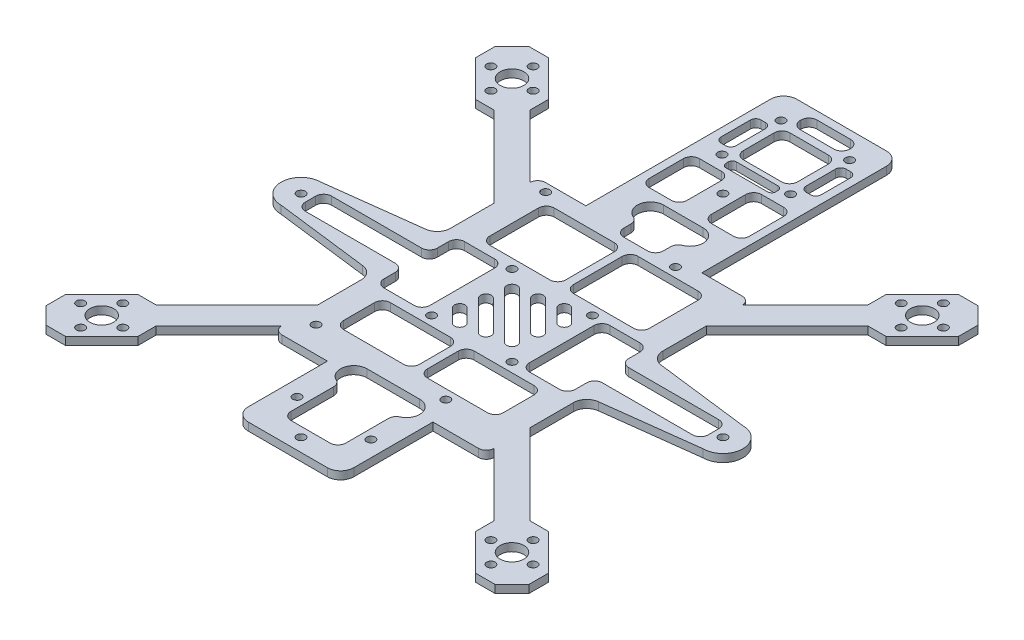
from build123d import *

# Parameters (mm, degrees)
SKETCH_1_R          = 1.6
EXTRUDE_1_DEPTH     = 3
SKETCH_6_R          = 1.6
EXTRUDE_3_DEPTH     = 3
SKETCH_7_R          = 1.6
CUT_EXTRUDE_5_DEPTH = 130.480195498
SKETCH_8_W          = 44
SKETCH_8_H          = 75
SKETCH_8_R          = 1.6
EXTRUDE_4_DEPTH     = 3
FILLET_1_R          = 5
FILLET_2_R          = 3
SKETCH_9_R          = 4.5
CUT_EXTRUDE_6_DEPTH = 155.958254098
FILLET_3_R          = 3


with BuildPart() as part:
    # 草图1 → 凸台-拉伸1 (new body)
    with BuildSketch(Plane(origin=(0, 0, 0), x_dir=(1, 0, 0), z_dir=(0, 1, 0))):
        with BuildLine():
            Line((-40.28, -16.916429648), (-40.28, -50))
            Line((-40.28, -50), (-20, -50))
            Line((-20, -50), (-20, -85))
            Line((-20, -85), (20, -85))
            Line((20, -85), (20, -50))
            Line((20, -50), (40.28, -50))
            Line((40.28, -50), (40.28, -16.916429648))
            ThreePointArc((40.28, -16.916429648), (41.5325458, -13.606356081), (44.662634807, -11.954690012))
            Line((44.662634807, -11.954690012), (80, -7.557833088))
            ThreePointArc((80, -7.557833088), (87.557833088, 0), (80, 7.557833088))
            Line((80, 7.557833088), (44.662634807, 11.954690012))
            ThreePointArc((44.662634807, 11.954690012), (41.5325458, 13.606356081), (40.28, 16.916429648))
            Line((40.28, 16.916429648), (40.28, 50))
            Line((40.28, 50), (-40.28, 50))
            Line((-40.28, 50), (-40.28, 16.916429648))
            ThreePointArc((-40.28, 16.916429648), (-41.5325458, 13.606356081), (-44.662634807, 11.954690012))
            Line((-44.662634807, 11.954690012), (-80, 7.557833088))
            ThreePointArc((-80, 7.557833088), (-87.557833088, 0), (-80, -7.557833088))
            Line((-80, -7.557833088), (-44.662634807, -11.954690012))
            ThreePointArc((-44.662634807, -11.954690012), (-41.5325458, -13.606356081), (-40.28, -16.916429648))
        make_face()
        with Locations(Location((-34.12, -40.19, 0), (0, 0, 270))):
            Circle(SKETCH_1_R, mode=Mode.SUBTRACT)
        with Locations(Location((15.09, -40.19, 0), (0, 0, 270))):
            Circle(SKETCH_1_R, mode=Mode.SUBTRACT)
        with Locations(Location((-80, 0, 0), (0, 0, 270))):
            Circle(SKETCH_1_R, mode=Mode.SUBTRACT)
        with Locations(Location((-15.25, -15.25, 0), (0, 0, 270))):
            Circle(SKETCH_1_R, mode=Mode.SUBTRACT)
        with Locations(Location((-15.25, 15.25, 0), (0, 0, 270))):
            Circle(SKETCH_1_R, mode=Mode.SUBTRACT)
        with Locations(Location((-34.12, 46.89, 0), (0, 0, 270))):
            Circle(SKETCH_1_R, mode=Mode.SUBTRACT)
        with Locations(Location((15.25, -15.25, 0), (0, 0, 270))):
            Circle(SKETCH_1_R, mode=Mode.SUBTRACT)
        with Locations(Location((15.25, 15.25, 0), (0, 0, 270))):
            Circle(SKETCH_1_R, mode=Mode.SUBTRACT)
        with Locations(Location((80, 0, 0), (0, 0, 270))):
            Circle(SKETCH_1_R, mode=Mode.SUBTRACT)
        with Locations(Location((15.09, 46.89, 0), (0, 0, 270))):
            Circle(SKETCH_1_R, mode=Mode.SUBTRACT)
        with Locations(Location((14, -67.5, 0), (0, 0, 270))):
            Circle(SKETCH_1_R, mode=Mode.SUBTRACT)
        with Locations(Location((-14, -67.5, 0), (0, 0, 270))):
            Circle(SKETCH_1_R, mode=Mode.SUBTRACT)
    extrude(amount=EXTRUDE_1_DEPTH)

    # 草图6 → 凸台-拉伸3 (add)
    # profile 1 of 4: a face of its own
    with BuildSketch(Plane(origin=(0, 0, 0), x_dir=(1, 0, 0), z_dir=(0, 1, 0))):
        Polygon((-40.28, 33.405), (-40.28, 47.155), (-64.031745931, 70.906745931), (-64.031745931, 77.781745931), (-77.781745931, 91.531745931), (-85.1677849, 91.531745931), (-91.531745931, 85.1677849), (-91.531745931, 77.781745931), (-77.781745931, 64.031745931), (-70.906745931, 64.031745931), align=None)
        with Locations(Location((-85.781745931, 77.781745931, 0), (0, 0, 270))):
            Circle(SKETCH_6_R, mode=Mode.SUBTRACT)
        with Locations(Location((-77.781745931, 69.781745931, 0), (0, 0, 270))):
            Circle(SKETCH_6_R, mode=Mode.SUBTRACT)
        with Locations(Location((-69.781745931, 77.781745931, 0), (0, 0, 270))):
            Circle(SKETCH_6_R, mode=Mode.SUBTRACT)
        with Locations(Location((-77.781745931, 85.781745931, 0), (0, 0, 270))):
            Circle(SKETCH_6_R, mode=Mode.SUBTRACT)
    # profile 2 of 4: a face of its own
    with BuildSketch(Plane(origin=(0, 0, 0), x_dir=(1, 0, 0), z_dir=(0, 1, 0))):
        Polygon((85.1677849, 91.531745931), (77.781745931, 91.531745931), (64.031745931, 77.781745931), (64.031745931, 70.906745931), (40.28, 47.155), (40.28, 33.405), (70.906745931, 64.031745931), (77.781745931, 64.031745931), (91.531745931, 77.781745931), (91.531745931, 85.1677849), align=None)
        with Locations(Location((77.781745931, 69.781745931, 0), (0, 0, 270))):
            Circle(SKETCH_6_R, mode=Mode.SUBTRACT)
        with Locations(Location((69.781745931, 77.781745931, 0), (0, 0, 270))):
            Circle(SKETCH_6_R, mode=Mode.SUBTRACT)
        with Locations(Location((85.781745931, 77.781745931, 0), (0, 0, 270))):
            Circle(SKETCH_6_R, mode=Mode.SUBTRACT)
        with Locations(Location((77.781745931, 85.781745931, 0), (0, 0, 270))):
            Circle(SKETCH_6_R, mode=Mode.SUBTRACT)
    # profile 3 of 4: a face of its own
    with BuildSketch(Plane(origin=(0, 0, 0), x_dir=(1, 0, 0), z_dir=(0, 1, 0))):
        Polygon((70.906745931, -64.031745931), (40.28, -33.405), (40.28, -47.155), (64.031745931, -70.906745931), (64.031745931, -77.781745931), (77.781745931, -91.531745931), (85.1677849, -91.531745931), (91.531745931, -85.1677849), (91.531745931, -77.781745931), (77.781745931, -64.031745931), align=None)
        with Locations(Location((77.781745931, -85.781745931, 0), (0, 0, 270))):
            Circle(SKETCH_6_R, mode=Mode.SUBTRACT)
        with Locations(Location((69.781745931, -77.781745931, 0), (0, 0, 270))):
            Circle(SKETCH_6_R, mode=Mode.SUBTRACT)
        with Locations(Location((77.781745931, -69.781745931, 0), (0, 0, 270))):
            Circle(SKETCH_6_R, mode=Mode.SUBTRACT)
        with Locations(Location((85.781745931, -77.781745931, 0), (0, 0, 270))):
            Circle(SKETCH_6_R, mode=Mode.SUBTRACT)
    # profile 4 of 4: a face of its own
    with BuildSketch(Plane(origin=(0, 0, 0), x_dir=(1, 0, 0), z_dir=(0, 1, 0))):
        Polygon((-40.28, -47.155), (-40.28, -33.405), (-70.906745931, -64.031745931), (-77.781745931, -64.031745931), (-91.531745931, -77.781745931), (-91.531745931, -85.1677849), (-85.1677849, -91.531745931), (-77.781745931, -91.531745931), (-64.031745931, -77.781745931), (-64.031745931, -70.906745931), align=None)
        with Locations(Location((-77.781745931, -85.781745931, 0), (0, 0, 270))):
            Circle(SKETCH_6_R, mode=Mode.SUBTRACT)
        with Locations(Location((-85.781745931, -77.781745931, 0), (0, 0, 270))):
            Circle(SKETCH_6_R, mode=Mode.SUBTRACT)
        with Locations(Location((-69.781745931, -77.781745931, 0), (0, 0, 270))):
            Circle(SKETCH_6_R, mode=Mode.SUBTRACT)
        with Locations(Location((-77.781745931, -69.781745931, 0), (0, 0, 270))):
            Circle(SKETCH_6_R, mode=Mode.SUBTRACT)
    extrude(amount=EXTRUDE_3_DEPTH)

    # 草图7 → 切除-拉伸5 (cut, through all)
    with BuildSketch(Plane(origin=(0, 0, 0), x_dir=(1, 0, 0), z_dir=(0, 1, 0))):
        with BuildLine():
            ThreePointArc((-6.01040764, -10.960155108), (-6.01040764, -13.788582233), (-8.838834765, -13.788582233))
            Line((-8.838834765, -13.788582233), (-13.788582233, -8.838834765))
            ThreePointArc((-13.788582233, -8.838834765), (-13.788582233, -6.01040764), (-10.960155108, -6.01040764))
            Line((-10.960155108, -6.01040764), (-6.01040764, -10.960155108))
        make_face()
        with BuildLine():
            ThreePointArc((2.121320344, -9.192388155), (2.121320344, -12.02081528), (-0.707106781, -12.02081528))
            Line((-0.707106781, -12.02081528), (-12.02081528, -0.707106781))
            ThreePointArc((-12.02081528, -0.707106781), (-12.02081528, 2.121320344), (-9.192388155, 2.121320344))
            Line((-9.192388155, 2.121320344), (2.121320344, -9.192388155))
        make_face()
        with BuildLine():
            Line((-10.253048327, 7.424621202), (7.424621202, -10.253048327))
            ThreePointArc((7.424621202, -10.253048327), (10.253048327, -10.253048327), (10.253048327, -7.424621202))
            Line((10.253048327, -7.424621202), (-7.424621202, 10.253048327))
            ThreePointArc((-7.424621202, 10.253048327), (-10.253048327, 10.253048327), (-10.253048327, 7.424621202))
        make_face()
        with BuildLine():
            Line((-2.121320344, 9.192388155), (9.192388155, -2.121320344))
            ThreePointArc((9.192388155, -2.121320344), (12.02081528, -2.121320344), (12.02081528, 0.707106781))
            Line((12.02081528, 0.707106781), (0.707106781, 12.02081528))
            ThreePointArc((0.707106781, 12.02081528), (-2.121320344, 12.02081528), (-2.121320344, 9.192388155))
        make_face()
        with BuildLine():
            Line((6.01040764, 10.960155108), (10.960155108, 6.01040764))
            ThreePointArc((10.960155108, 6.01040764), (13.788582233, 6.01040764), (13.788582233, 8.838834765))
            Line((13.788582233, 8.838834765), (8.838834765, 13.788582233))
            ThreePointArc((8.838834765, 13.788582233), (6.01040764, 13.788582233), (6.01040764, 10.960155108))
        make_face()
        with BuildLine():
            Line((-10, -55), (10, -55))
            ThreePointArc((10, -55), (15, -50), (10, -45))
            Line((10, -45), (-10, -45))
            ThreePointArc((-10, -45), (-15, -50), (-10, -55))
        make_face()
        with Locations(Location((0, -80, 0), (0, 0, 270))):
            Circle(SKETCH_7_R)
    extrude(amount=CUT_EXTRUDE_5_DEPTH, mode=Mode.SUBTRACT)

    # 草图8 → 凸台-拉伸4 (add)
    with BuildSketch(Plane(origin=(0, 0, 0), x_dir=(1, 0, 0), z_dir=(0, 1, 0))):
        with Locations((0, 87.5)):
            Rectangle(SKETCH_8_W, SKETCH_8_H)
        with Locations(Location((13, 115, 0), (0, 0, 270))):
            Circle(SKETCH_8_R, mode=Mode.SUBTRACT)
        with Locations(Location((-13, 115, 0), (0, 0, 90))):
            Circle(SKETCH_8_R, mode=Mode.SUBTRACT)
        with Locations(Location((13, 92.63, 0), (0, 0, 270))):
            Circle(SKETCH_8_R, mode=Mode.SUBTRACT)
        with Locations(Location((-13, 92.63, 0), (0, 0, 90))):
            Circle(SKETCH_8_R, mode=Mode.SUBTRACT)
        with Locations(Location((0, 80, 0), (0, 0, 270))):
            Circle(SKETCH_8_R, mode=Mode.SUBTRACT)
        with BuildLine():
            Line((-7.5, 65), (7.5, 65))
            ThreePointArc((7.5, 65), (12.5, 60), (7.5, 55))
            Line((7.5, 55), (-7.5, 55))
            ThreePointArc((-7.5, 55), (-12.5, 60), (-7.5, 65))
        make_face(mode=Mode.SUBTRACT)
    extrude(amount=EXTRUDE_4_DEPTH)

    # 圆角1
    fillet_1_edges = [part.edges().sort_by_distance(p)[0] for p in [
        (22, 1.5, -125),
        (-22, 1.5, -125),
        (20, 1.5, 85),
        (-20, 1.5, 85),
    ]]
    fillet(fillet_1_edges, radius=FILLET_1_R)

    # 圆角2
    # the kernel refuses this fillet: 3 mm, written as the material it takes off along each edge
    with BuildSketch(Plane(origin=(-40.28, -7.489982894, 50), x_dir=(1, 0, 0), z_dir=(0, 1, 0))) as fillet_2_piece_1_section:
        with BuildLine():
            CenterArc((2.995993158, 3), FILLET_2_R, 182.961600578, 87.038399422)
            Line((0, 2.845), (-0.059919863, 2.8419))
            ThreePointArc((-0.059919863, 2.8419), (-0.06, 1.4225), (-0.06, 0))
            Line((-0.06, 0), (0, -0.06))
            Line((0, -0.06), (2.995993158, -0.06))
            Line((2.995993158, -0.06), (2.995993158, 0))
        make_face()
    fillet_2_piece_1 = extrude(amount=17.979965788, mode=Mode.PRIVATE)
    fillet_2_piece_1 = split(fillet_2_piece_1, bisect_by=Plane(origin=(-41.028477844, 1.5, 47.903477844), z_dir=(0.7071067811865611, 0, 0.7071067811865339)), keep=Keep.TOP, mode=Mode.PRIVATE)
    add(fillet_2_piece_1, mode=Mode.SUBTRACT)
    with BuildSketch(Plane(origin=(40.28, -7.489982894, 50), x_dir=(-1, 0, 0), z_dir=(0, 1, 0))) as fillet_2_piece_2_section:
        with BuildLine():
            CenterArc((2.995993158, -3), FILLET_2_R, 90, 87.038399422)
            Line((0, -2.845), (-0.059919863, -2.8419))
            ThreePointArc((-0.059919863, -2.8419), (-0.06, -1.4225), (-0.06, 0))
            Line((-0.06, 0), (0, 0.06))
            Line((0, 0.06), (2.995993158, 0.06))
            Line((2.995993158, 0.06), (2.995993158, 0))
        make_face()
    fillet_2_piece_2 = extrude(amount=17.979965788, mode=Mode.PRIVATE)
    fillet_2_piece_2 = split(fillet_2_piece_2, bisect_by=Plane(origin=(41.028477844, 1.5, 47.903477844), z_dir=(-0.7071067811865506, 0, 0.7071067811865445)), keep=Keep.TOP, mode=Mode.PRIVATE)
    add(fillet_2_piece_2, mode=Mode.SUBTRACT)
    with BuildSketch(Plane(origin=(40.28, -7.489982894, -50), x_dir=(0, 0, 1), z_dir=(0, 1, 0))) as fillet_2_piece_3_section:
        with BuildLine():
            CenterArc((3, -2.995993158), FILLET_2_R, 92.961600577, 87.038399423)
            Line((0, -2.995993158), (-0.06, -2.995993158))
            Line((-0.06, -2.995993158), (-0.06, 0))
            Line((-0.06, 0), (0, 0.06))
            ThreePointArc((0, 0.06), (1.4225, 0.06), (2.8419, 0.059919863))
            Line((2.8419, 0.059919863), (2.845, 0))
        make_face()
    fillet_2_piece_3 = extrude(amount=17.979965788, mode=Mode.PRIVATE)
    fillet_2_piece_3 = split(fillet_2_piece_3, bisect_by=Plane(origin=(41.028477844, 1.5, -47.903477844), z_dir=(-0.7071067811865489, 0, -0.7071067811865461)), keep=Keep.TOP, mode=Mode.PRIVATE)
    add(fillet_2_piece_3, mode=Mode.SUBTRACT)
    with BuildSketch(Plane(origin=(-40.28, -7.489982894, -50), x_dir=(0, 0, 1), z_dir=(0, 1, 0))) as fillet_2_piece_4_section:
        with BuildLine():
            CenterArc((3, 2.995993158), FILLET_2_R, 180, 87.038399422)
            Line((0, 2.995993158), (-0.06, 2.995993158))
            Line((-0.06, 2.995993158), (-0.06, 0))
            Line((-0.06, 0), (0, -0.06))
            ThreePointArc((0, -0.06), (1.4225, -0.06), (2.8419, -0.059919863))
            Line((2.8419, -0.059919863), (2.845, 0))
        make_face()
    fillet_2_piece_4 = extrude(amount=17.979965788, mode=Mode.PRIVATE)
    fillet_2_piece_4 = split(fillet_2_piece_4, bisect_by=Plane(origin=(-41.028477844, 1.5, -47.903477844), z_dir=(0.7071067811865613, 0, -0.7071067811865338)), keep=Keep.TOP, mode=Mode.PRIVATE)
    add(fillet_2_piece_4, mode=Mode.SUBTRACT)

    # 草图9 → 切除-拉伸6 (cut, through all)
    with BuildSketch(Plane(origin=(0, 0, 0), x_dir=(1, 0, 0), z_dir=(0, 1, 0))):
        with Locations(Location((77.781745931, 77.781745931, 0), (0, 0, 270))):
            Circle(SKETCH_9_R)
        with Locations(Location((77.781745931, -77.781745931, 0), (0, 0, 270))):
            Circle(SKETCH_9_R)
        with Locations(Location((-77.781745931, -77.781745931, 0), (0, 0, 270))):
            Circle(SKETCH_9_R)
        with Locations(Location((-77.781745931, 77.781745931, 0), (0, 0, 270))):
            Circle(SKETCH_9_R)
        with BuildLine():
            Line((-7.271052245, 94.977944665), (7.271052245, 94.977944665))
            ThreePointArc((7.271052245, 94.977944665), (9.392372588, 95.856624321), (10.271052245, 97.977944665))
            Line((10.271052245, 97.977944665), (10.271052245, 109.652055335))
            ThreePointArc((10.271052245, 109.652055335), (9.392372588, 111.773375679), (7.271052245, 112.652055335))
            Line((7.271052245, 112.652055335), (-7.271052245, 112.652055335))
            ThreePointArc((-7.271052245, 112.652055335), (-9.392372588, 111.773375679), (-10.271052245, 109.652055335))
            Line((-10.271052245, 109.652055335), (-10.271052245, 97.977944665))
            ThreePointArc((-10.271052245, 97.977944665), (-9.392372588, 95.856624321), (-7.271052245, 94.977944665))
        make_face()
        with BuildLine():
            Line((-27.28, 43.293557313), (-4.5, 43.293557313))
            ThreePointArc((-4.5, 43.293557313), (-2.378679656, 42.414877657), (-1.5, 40.293557313))
            Line((-1.5, 40.293557313), (-1.5, 21.85))
            ThreePointArc((-1.5, 21.85), (-2.378679656, 19.728679656), (-4.5, 18.85))
            Line((-4.5, 18.85), (-27.28, 18.85))
            ThreePointArc((-27.28, 18.85), (-29.401320344, 19.728679656), (-30.28, 21.85))
            Line((-30.28, 21.85), (-30.28, 40.293557313))
            ThreePointArc((-30.28, 40.293557313), (-29.401320344, 42.414877657), (-27.28, 43.293557313))
        make_face()
        with BuildLine():
            Line((30.28, 40.293557313), (30.28, 21.85))
            ThreePointArc((30.28, 21.85), (29.401320344, 19.728679656), (27.28, 18.85))
            Line((27.28, 18.85), (4.5, 18.85))
            ThreePointArc((4.5, 18.85), (2.378679656, 19.728679656), (1.5, 21.85))
            Line((1.5, 21.85), (1.5, 40.293557313))
            ThreePointArc((1.5, 40.293557313), (2.378679656, 42.414877657), (4.5, 43.293557313))
            Line((4.5, 43.293557313), (27.28, 43.293557313))
            ThreePointArc((27.28, 43.293557313), (29.401320344, 42.414877657), (30.28, 40.293557313))
        make_face()
        with BuildLine():
            Line((-73.4, 4.982630389), (-39.28, 4.982630389))
            ThreePointArc((-39.28, 4.982630389), (-37.158679656, 5.861310045), (-36.28, 7.982630389))
            Line((-36.28, 7.982630389), (-36.28, 12.25))
            ThreePointArc((-36.28, 12.25), (-35.401320344, 14.371320344), (-33.28, 15.25))
            Line((-33.28, 15.25), (-21.85, 15.25))
            ThreePointArc((-21.85, 15.25), (-19.728679656, 14.371320344), (-18.85, 12.25))
            Line((-18.85, 12.25), (-18.85, 4.982630389))
            Line((-18.85, 4.982630389), (-18.85, -1.982630389))
            Line((-18.85, -1.982630389), (-18.85, -12.25))
            ThreePointArc((-18.85, -12.25), (-19.728679656, -14.371320344), (-21.85, -15.25))
            Line((-21.85, -15.25), (-33.28, -15.25))
            ThreePointArc((-33.28, -15.25), (-35.401320344, -14.371320344), (-36.28, -12.25))
            Line((-36.28, -12.25), (-36.28, -7.982630389))
            ThreePointArc((-36.28, -7.982630389), (-37.158679656, -5.861310045), (-39.28, -4.982630389))
            Line((-39.28, -4.982630389), (-73.4, -4.982630389))
            ThreePointArc((-73.4, -4.982630389), (-75.521320344, -4.103950732), (-76.4, -1.982630389))
            Line((-76.4, -1.982630389), (-76.4, 1.982630389))
            ThreePointArc((-76.4, 1.982630389), (-75.521320344, 4.103950732), (-73.4, 4.982630389))
        make_face()
        with BuildLine():
            Line((18.85, 1.982630389), (18.85, -1.982630389))
            Line((18.85, -1.982630389), (18.85, -12.25))
            ThreePointArc((18.85, -12.25), (19.728679656, -14.371320344), (21.85, -15.25))
            Line((21.85, -15.25), (33.28, -15.25))
            ThreePointArc((33.28, -15.25), (35.401320344, -14.371320344), (36.28, -12.25))
            Line((36.28, -12.25), (36.28, -7.982630389))
            ThreePointArc((36.28, -7.982630389), (37.158679656, -5.861310045), (39.28, -4.982630389))
            Line((39.28, -4.982630389), (73.4, -4.982630389))
            ThreePointArc((73.4, -4.982630389), (75.521320344, -4.103950732), (76.4, -1.982630389))
            Line((76.4, -1.982630389), (76.4, 1.982630389))
            ThreePointArc((76.4, 1.982630389), (75.521320344, 4.103950732), (73.4, 4.982630389))
            Line((73.4, 4.982630389), (39.28, 4.982630389))
            ThreePointArc((39.28, 4.982630389), (37.158679656, 5.861310045), (36.28, 7.982630389))
            Line((36.28, 7.982630389), (36.28, 12.25))
            ThreePointArc((36.28, 12.25), (35.401320344, 14.371320344), (33.28, 15.25))
            Line((33.28, 15.25), (21.85, 15.25))
            ThreePointArc((21.85, 15.25), (19.728679656, 14.371320344), (18.85, 12.25))
            Line((18.85, 12.25), (18.85, 1.982630389))
        make_face()
        with BuildLine():
            Line((-27.28, -18.85), (-4.5, -18.85))
            ThreePointArc((-4.5, -18.85), (-2.378679656, -19.728679656), (-1.5, -21.85))
            Line((-1.5, -21.85), (-1.5, -33.593557313))
            ThreePointArc((-1.5, -33.593557313), (-2.378679656, -35.714877657), (-4.5, -36.593557313))
            Line((-4.5, -36.593557313), (-27.28, -36.593557313))
            ThreePointArc((-27.28, -36.593557313), (-29.401320344, -35.714877657), (-30.28, -33.593557313))
            Line((-30.28, -33.593557313), (-30.28, -21.85))
            ThreePointArc((-30.28, -21.85), (-29.401320344, -19.728679656), (-27.28, -18.85))
        make_face()
        with BuildLine():
            Line((30.28, -21.85), (30.28, -33.593557313))
            ThreePointArc((30.28, -33.593557313), (29.401320344, -35.714877657), (27.28, -36.593557313))
            Line((27.28, -36.593557313), (4.5, -36.593557313))
            ThreePointArc((4.5, -36.593557313), (2.378679656, -35.714877657), (1.5, -33.593557313))
            Line((1.5, -33.593557313), (1.5, -21.85))
            ThreePointArc((1.5, -21.85), (2.378679656, -19.728679656), (4.5, -18.85))
            Line((4.5, -18.85), (27.28, -18.85))
            ThreePointArc((27.28, -18.85), (29.401320344, -19.728679656), (30.28, -21.85))
        make_face()
        with BuildLine():
            Line((-10.4, -54.983974318), (-10.4, -73.4))
            ThreePointArc((-10.4, -73.4), (-9.521320344, -75.521320344), (-7.4, -76.4))
            Line((-7.4, -76.4), (7.4, -76.4))
            ThreePointArc((7.4, -76.4), (9.521320344, -75.521320344), (10.4, -73.4))
            Line((10.4, -73.4), (10.4, -54.983974318))
            Line((10.4, -54.983974318), (-10.4, -54.983974318))
        make_face()
        with BuildLine():
            Line((7.6, 87.03), (16, 87.03))
            ThreePointArc((16, 87.03), (18.121320344, 86.151320344), (19, 84.03))
            Line((19, 84.03), (19, 71))
            ThreePointArc((19, 71), (18.121320344, 68.878679656), (16, 68))
            Line((16, 68), (7.6, 68))
            ThreePointArc((7.6, 68), (5.478679656, 68.878679656), (4.6, 71))
            Line((4.6, 71), (4.6, 84.03))
            ThreePointArc((4.6, 84.03), (5.478679656, 86.151320344), (7.6, 87.03))
        make_face()
        with BuildLine():
            Line((-19, 84.03), (-19, 71))
            ThreePointArc((-19, 71), (-18.121320344, 68.878679656), (-16, 68))
            Line((-16, 68), (-7.6, 68))
            ThreePointArc((-7.6, 68), (-5.478679656, 68.878679656), (-4.6, 71))
            Line((-4.6, 71), (-4.6, 84.03))
            ThreePointArc((-4.6, 84.03), (-5.478679656, 86.151320344), (-7.6, 87.03))
            Line((-7.6, 87.03), (-16, 87.03))
            ThreePointArc((-16, 87.03), (-18.121320344, 86.151320344), (-19, 84.03))
        make_face()
        with BuildLine():
            Line((-15.271052245, 96.23), (-17, 96.23))
            ThreePointArc((-17, 96.23), (-18.414213562, 96.815786438), (-19, 98.23))
            Line((-19, 98.23), (-19, 109.4))
            ThreePointArc((-19, 109.4), (-18.414213562, 110.814213562), (-17, 111.4))
            Line((-17, 111.4), (-15.271052245, 111.4))
            ThreePointArc((-15.271052245, 111.4), (-13.856838682, 110.814213562), (-13.271052245, 109.4))
            Line((-13.271052245, 109.4), (-13.271052245, 98.23))
            ThreePointArc((-13.271052245, 98.23), (-13.856838682, 96.815786438), (-15.271052245, 96.23))
        make_face()
        with BuildLine():
            Line((-6.4, 122), (6.4, 122))
            ThreePointArc((6.4, 122), (8.521320344, 121.121320344), (9.4, 119))
            Line((9.4, 119), (9.4, 118.652055335))
            ThreePointArc((9.4, 118.652055335), (8.521320344, 116.530734992), (6.4, 115.652055335))
            Line((6.4, 115.652055335), (-6.4, 115.652055335))
            ThreePointArc((-6.4, 115.652055335), (-8.521320344, 116.530734992), (-9.4, 118.652055335))
            Line((-9.4, 118.652055335), (-9.4, 119))
            ThreePointArc((-9.4, 119), (-8.521320344, 121.121320344), (-6.4, 122))
        make_face()
        with BuildLine():
            Line((15.271052245, 111.4), (17, 111.4))
            ThreePointArc((17, 111.4), (18.414213562, 110.814213562), (19, 109.4))
            Line((19, 109.4), (19, 98.23))
            ThreePointArc((19, 98.23), (18.414213562, 96.815786438), (17, 96.23))
            Line((17, 96.23), (15.271052245, 96.23))
            ThreePointArc((15.271052245, 96.23), (13.856838682, 96.815786438), (13.271052245, 98.23))
            Line((13.271052245, 98.23), (13.271052245, 109.4))
            ThreePointArc((13.271052245, 109.4), (13.856838682, 110.814213562), (15.271052245, 111.4))
        make_face()
        with BuildLine():
            Line((-7.5, 55), (-7.5, 49.89))
            ThreePointArc((-7.5, 49.89), (-6.621320344, 47.768679656), (-4.5, 46.89))
            Line((-4.5, 46.89), (4.5, 46.89))
            ThreePointArc((4.5, 46.89), (6.621320344, 47.768679656), (7.5, 49.89))
            Line((7.5, 49.89), (7.5, 55))
            Line((7.5, 55), (-7.5, 55))
        make_face()
        with BuildLine():
            Line((-7.9, 92.977944665), (7.9, 92.977944665))
            ThreePointArc((7.9, 92.977944665), (8.960660172, 92.538604837), (9.4, 91.477944665))
            Line((9.4, 91.477944665), (9.4, 90.53))
            ThreePointArc((9.4, 90.53), (8.960660172, 89.469339828), (7.9, 89.03))
            Line((7.9, 89.03), (-7.9, 89.03))
            ThreePointArc((-7.9, 89.03), (-8.960660172, 89.469339828), (-9.4, 90.53))
            Line((-9.4, 90.53), (-9.4, 91.477944665))
            ThreePointArc((-9.4, 91.477944665), (-8.960660172, 92.538604837), (-7.9, 92.977944665))
        make_face()
    extrude(amount=CUT_EXTRUDE_6_DEPTH, mode=Mode.SUBTRACT)

    # 圆角3
    fillet_3_edges = [part.edges().sort_by_distance(p)[0] for p in [
        (-7.5, 1.5, -55),
        (7.5, 1.5, -55),
        (10.4, 1.5, 54.983974318),
        (-10.4, 1.5, 54.983974318),
    ]]
    fillet(fillet_3_edges, radius=FILLET_3_R)


solid = part.part
